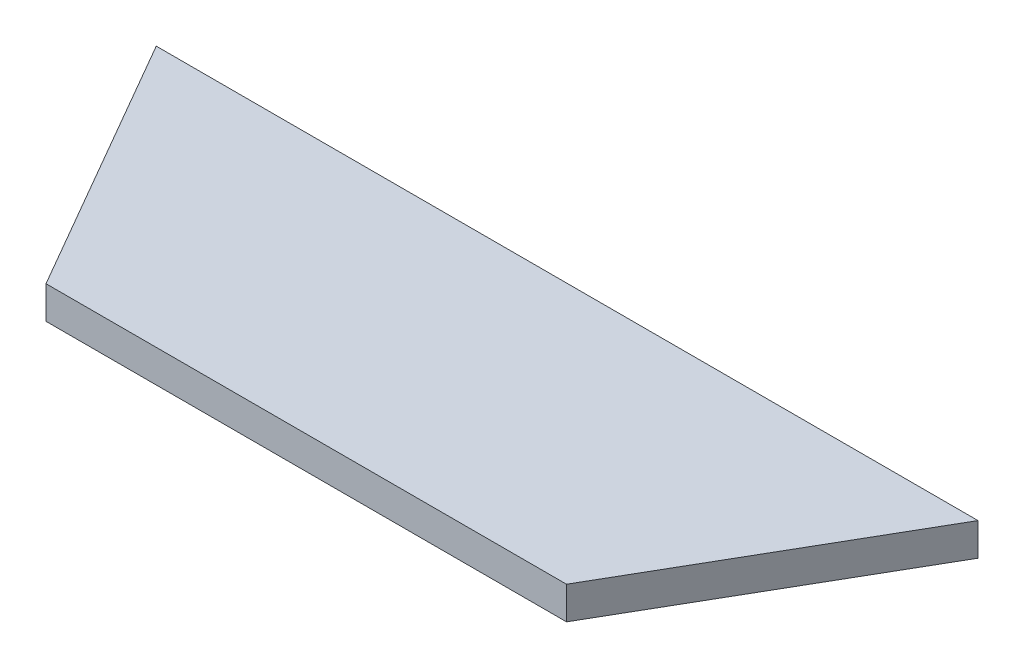
from build123d import *

# Parameters (mm, degrees)
EXTRUDE_1_DEPTH = 5


with BuildPart() as part:
    # Эскиз1 → Бобышка-Вытянуть1 (new body)
    with BuildSketch(Plane(origin=(0, 0, 0), x_dir=(1, 0, 0), z_dir=(0, 1, 0))):
        Polygon((0, 0), (79.81197846, 0), (102.905989228, 40), (-23.094010768, 40), align=None)
    extrude(amount=EXTRUDE_1_DEPTH)


solid = part.part
